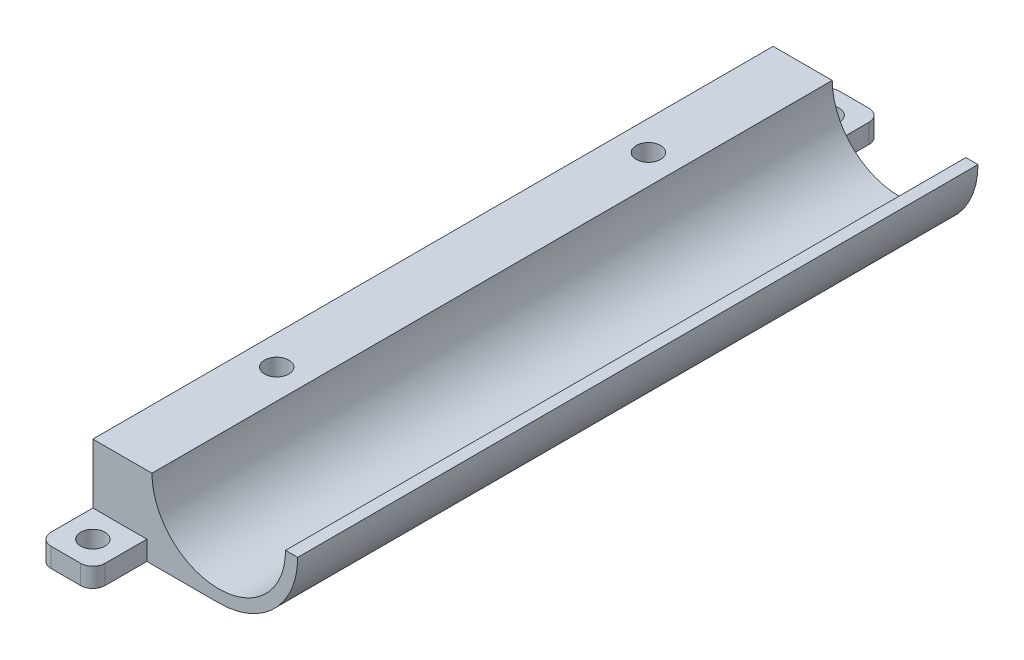
from build123d import *

# Parameters (mm, degrees)
BOSS_EXTRUDE1_DEPTH = 112
SKETCH2_R           = 2
CUT_EXTRUDE1_DEPTH  = 5
SKETCH3_W           = 8.89
SKETCH3_H           = 8.89
SKETCH3_R           = 2
BOSS_EXTRUDE2_DEPTH = 3.175
FILLET1_R           = 2


with BuildPart() as part:
    # Sketch1 → Boss-Extrude1 (new body)
    with BuildSketch(Plane.XY):
        with BuildLine():
            Line((-20.724457785, -13), (0, -13))
            ThreePointArc((0, -13), (9.192388155, -9.192388155), (13, 0))
            Line((13, 0), (11, 0))
            ThreePointArc((11, 0), (0, -11), (-11, 0))
            Line((-11, 0), (-20.724457785, 0))
            Line((-20.724457785, 0), (-20.724457785, -13))
        make_face()
    extrude(amount=BOSS_EXTRUDE1_DEPTH)

    # Sketch2 → Cut-Extrude1 (cut)
    with BuildSketch(Plane(origin=(0, 0, 0), x_dir=(1, 0, 0), z_dir=(0, 1, 0))):
        with Locations((-15.862228893, -25.4)):
            Circle(SKETCH2_R)
        with Locations((-15.862228893, -86.6)):
            Circle(SKETCH2_R)
    extrude(amount=-CUT_EXTRUDE1_DEPTH, mode=Mode.SUBTRACT)

    # Sketch3 → Boss-Extrude2 (add)
    # profile 1 of 2: a face of its own
    with BuildSketch(Plane.XZ.offset(13)):
        with Locations((-16.279457785, 116.445)):
            Rectangle(SKETCH3_W, SKETCH3_H)
        with Locations((-16.279457785, 116.445)):
            Circle(SKETCH3_R, mode=Mode.SUBTRACT)
    # profile 2 of 2: a face of its own
    with BuildSketch(Plane.XZ.offset(13)):
        with Locations((-16.279457785, -4.445)):
            Rectangle(SKETCH3_W, SKETCH3_H)
        with Locations((-16.279457785, -4.445)):
            Circle(SKETCH3_R, mode=Mode.SUBTRACT)
    extrude(amount=-BOSS_EXTRUDE2_DEPTH)

    # Fillet1
    fillet1_edges = [part.edges().sort_by_distance(p)[0] for p in [
        (-20.724457785, -11.4125, 120.89),
        (-11.834457785, -11.4125, 120.89),
        (-11.834457785, -11.4125, -8.89),
        (-20.724457785, -11.4125, -8.89),
    ]]
    fillet(fillet1_edges, radius=FILLET1_R)


solid = part.part
